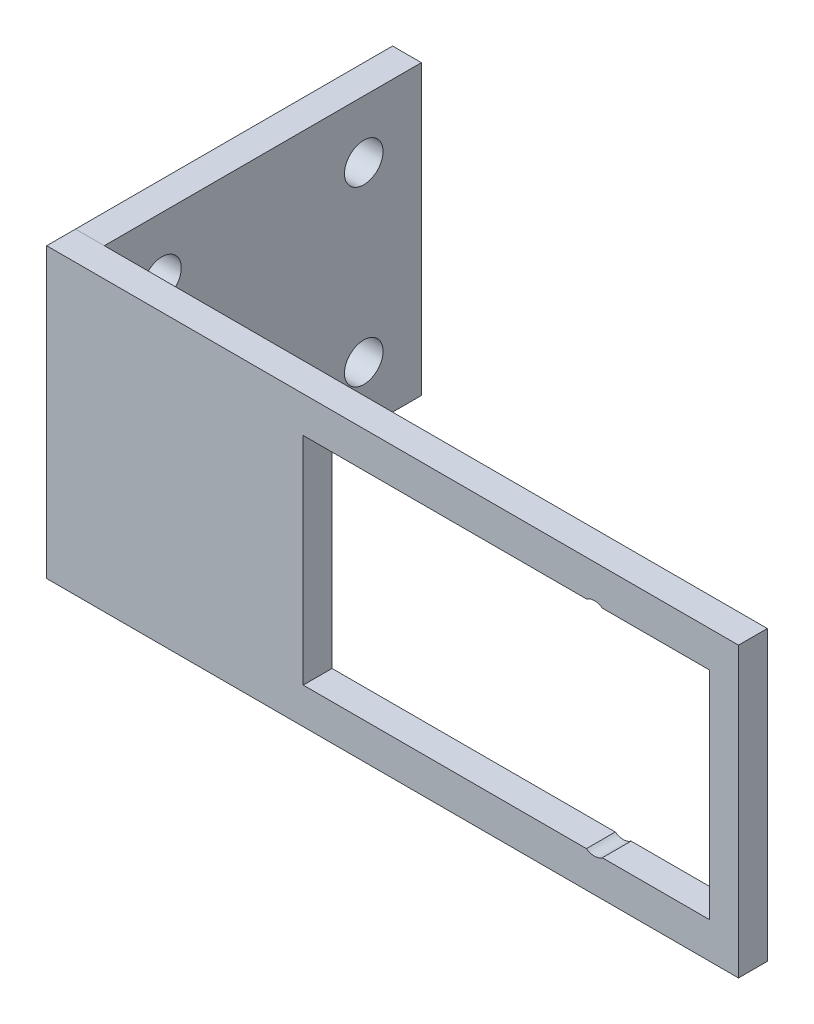
from build123d import *

# Parameters (mm, degrees)
SKETCH1_W                           = 27.94
SKETCH1_H                           = 25.4
SIDE_CONNECTING_TO_GRIP_DEPTH       = 2.54
M3_CLEARANCE_HOLE1_D                = 3.4
SIDE_CONNECTING_TO_SERVO_DEPTH      = 58.42
SIDE_CONNECTING_TO_SERVO_DEPTH_BACK = 2.54
SKETCH6_W                           = 2.54
SKETCH6_H                           = 25.4
SKETCH9_W                           = 1.2
SKETCH9_H                           = 30.48
CUTOUT_SERVO_HOLES_AT_2_COUNT       = 2
CUTOUT_SERVO_HOLES_AT_2_PITCH       = 17.1
SKETCH10_W                          = 35.814
SKETCH10_H                          = 19.05
CUT_EXTRUDE1_DEPTH                  = 2.54


with BuildPart() as part:
    # Sketch1 → side connecting to grip (new body)
    with BuildSketch(Plane(origin=(0, 0, 0), x_dir=(0, 0, -1), z_dir=(1, 0, 0))):
        with Locations((-31.87684378, 4.036305379)):
            Rectangle(SKETCH1_W, SKETCH1_H)
    extrude(amount=SIDE_CONNECTING_TO_GRIP_DEPTH)

    # M3 Clearance Hole1 (through all)
    with Locations(Plane(origin=(2.54, 0, 0), x_dir=(0, 0, -1), z_dir=(1, 0, 0))):
        with Locations((-40.76684378, 11.656305379), (-22.98684378, 11.656305379), (-22.98684378, -3.583694621), (-40.76684378, -3.583694621)):
            Hole(M3_CLEARANCE_HOLE1_D / 2)


with BuildPart() as body_2:
    # Sketch6 → side connecting to servo (new, two sides: drawn at the far end of the back side and taken through both)
    with BuildSketch(Plane(origin=(2.54, 0, 0), x_dir=(0, 0, -1), z_dir=(1, 0, 0)).offset(-SIDE_CONNECTING_TO_SERVO_DEPTH_BACK)):
        with Locations((-47.11684378, 4.036305379)):
            Rectangle(SKETCH6_W, SKETCH6_H)
    extrude(amount=SIDE_CONNECTING_TO_SERVO_DEPTH + SIDE_CONNECTING_TO_SERVO_DEPTH_BACK)

    # Sketch9 → cutout servo holes (revolve, cut)
    with BuildSketch(Plane(origin=(48.26, 12.586305379, 48.38684378), x_dir=(0, -1, 0), z_dir=(1, 0, 0))):
        with Locations((0.6, 15.24)):
            Rectangle(SKETCH9_W, SKETCH9_H)
    cutout_servo_holes = revolve(axis=Axis((48.26, 12.586305379, 54.73684378), (0, 0, -1)), mode=Mode.SUBTRACT)

    # cutout servo holes at 2: cutout servo holes ×2
    with Locations(*[(0, -i * CUTOUT_SERVO_HOLES_AT_2_PITCH, 0) for i in range(1, CUTOUT_SERVO_HOLES_AT_2_COUNT)]):
        add(cutout_servo_holes, mode=Mode.SUBTRACT)

    # Sketch10 → Cut-Extrude1 (cut)
    with BuildSketch(Plane.XY.offset(48.38684378)):
        with Locations((40.513, 4.036305379)):
            Rectangle(SKETCH10_W, SKETCH10_H)
    extrude(amount=-CUT_EXTRUDE1_DEPTH, mode=Mode.SUBTRACT)


solid = Compound([part.part, body_2.part])
